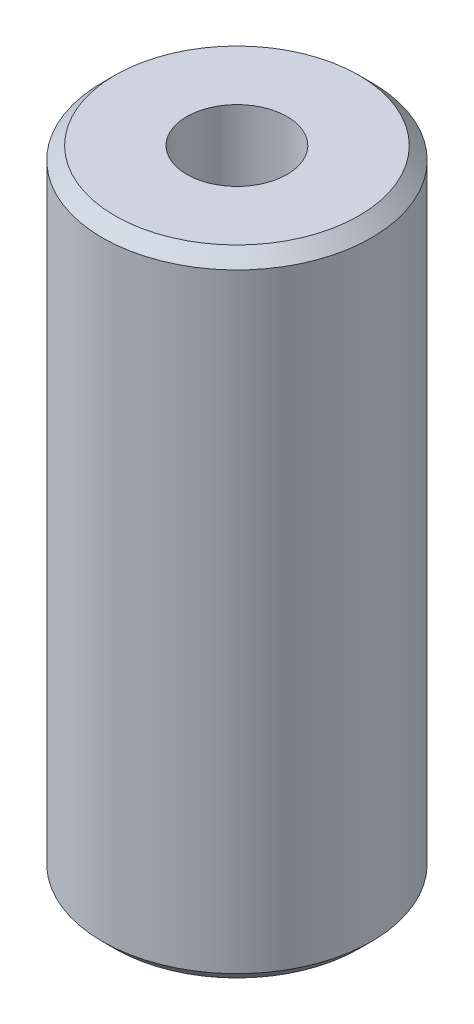
from build123d import *

# Parameters (mm, degrees)
SKETCH1_R           = 52.5
BOSS_EXTRUDE1_DEPTH = 247.697142782
SKETCH2_R           = 19.568299798
CUT_EXTRUDE1_DEPTH  = 259.585333193
CHAMFER1_SIZE       = 4.945397137


with BuildPart() as part:
    # Sketch1 → Boss-Extrude1 (new body)
    with BuildSketch(Plane(origin=(0, 0, 0), x_dir=(1, 0, 0), z_dir=(0, 1, 0))):
        Circle(SKETCH1_R)
    extrude(amount=BOSS_EXTRUDE1_DEPTH)

    # Sketch2 → Cut-Extrude1 (cut, through all)
    with BuildSketch(Plane(origin=(0, 0, 0), x_dir=(1, 0, 0), z_dir=(0, 1, 0))):
        Circle(SKETCH2_R)
    extrude(amount=CUT_EXTRUDE1_DEPTH, mode=Mode.SUBTRACT)

    # Chamfer1
    chamfer1_edges = [part.edges().sort_by_distance(p)[0] for p in [
        (-52.5, 247.697142782, 0),
        (-52.5, 0, 0),
    ]]
    chamfer(chamfer1_edges, length=CHAMFER1_SIZE)


solid = part.part
